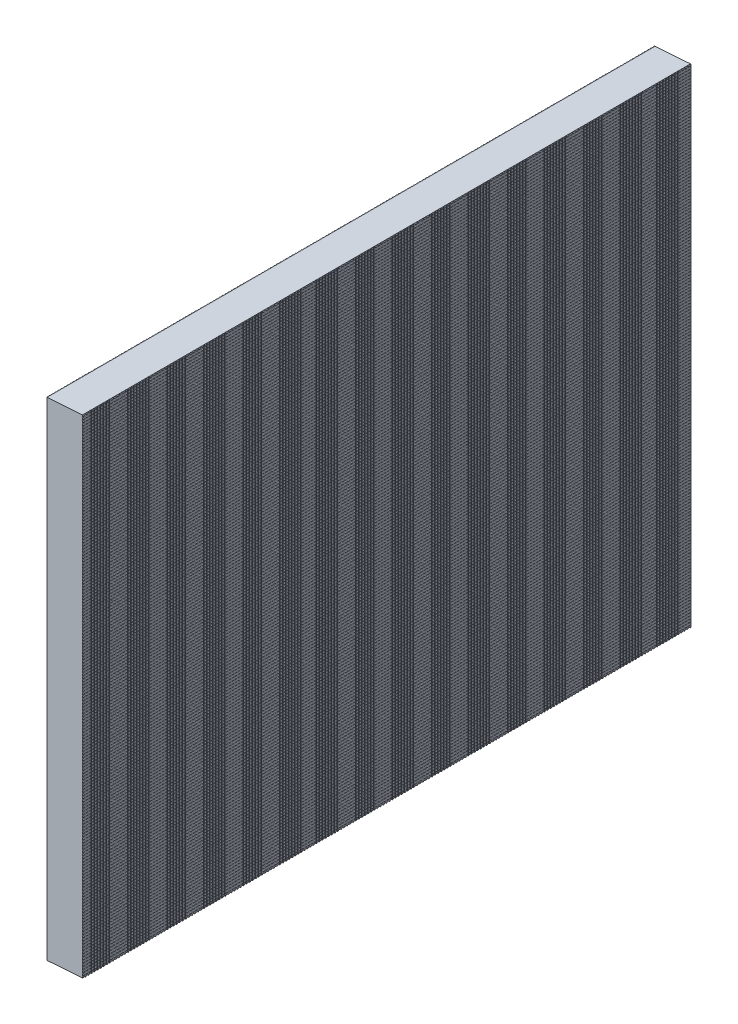
from build123d import *

# Parameters (mm, degrees)
BOSS_EXTRUDE1_DEPTH   = 400
SHELL1_T              = -1
SKETCH2_W             = 400
SKETCH2_H             = 320.8
BOSS_EXTRUDE2_DEPTH   = 0.6
CUT_EXTRUDE1_DEPTH    = 514.274663314
SKETCH4_W             = 0.4
SKETCH4_H             = 0.6
EXTRUDE_THIN1_DEPTH   = 400
EXTRUDE_THIN1_2_DEPTH = 400
LPATTERN1_COUNT       = 178
LPATTERN1_PITCH       = 1.8
SKETCH5_W             = 0.2
SKETCH5_H             = 0.6
BOSS_EXTRUDE3_DEPTH   = 320.8
BOSS_EXTRUDE4_START   = -319.777698
SKETCH6_W             = 0.2
SKETCH6_H             = 0.6
BOSS_EXTRUDE4_DEPTH   = 320.8
LPATTERN2_COUNT       = 200
LPATTERN2_PITCH       = 2
SKETCH7_R             = 7.795
SKETCH7_R_2           = 3.15
BOSS_EXTRUDE5_DEPTH   = 23.2
BOSS_EXTRUDE5_2_DEPTH = 23.2
BOSS_EXTRUDE5_3_DEPTH = 23.2
BOSS_EXTRUDE5_4_DEPTH = 23.2


with BuildPart() as part:
    # Sketch1 → Boss-Extrude1 (new body)
    with BuildSketch(Plane.XY):
        Polygon((0, 0), (0, 320.8), (-23.2, 319.177697963), (-23.2, -1.622302037), align=None)
    extrude(amount=BOSS_EXTRUDE1_DEPTH)

    # Shell1
    shell1_openings = [part.faces().sort_by_distance(p)[0] for p in [
        (0, 160.4, 200),
    ]]
    offset(amount=SHELL1_T, openings=shell1_openings, kind=Kind.INTERSECTION)

    # Sketch2 → Boss-Extrude2 (add)
    with BuildSketch(Plane(origin=(0, 0, 0), x_dir=(0, 0, -1), z_dir=(1, 0, 0))):
        with Locations((-200, 160.4)):
            Rectangle(SKETCH2_W, SKETCH2_H)
    extrude(amount=-BOSS_EXTRUDE2_DEPTH)

    # Sketch3 → Cut-Extrude1 (cut, through all)
    with BuildSketch(Plane(origin=(0, 0, 0), x_dir=(-1, 0, 0), z_dir=(0, 0, -1))):
        Polygon((0.6, 320.758043913), (0, 320.8), (0.6, 320.8), align=None)
    extrude(amount=-CUT_EXTRUDE1_DEPTH, mode=Mode.SUBTRACT)


with BuildPart() as body_2:
    # Sketch4 → Extrude-Thin1 (new body)
    with BuildSketch(Plane(origin=(0, 0, 0), x_dir=(-1, 0, 0), z_dir=(0, 0, -1))):
        with Locations((23.2, 318.877697963)):
            Rectangle(SKETCH4_W, SKETCH4_H)
    extrude_thin1 = extrude(amount=-EXTRUDE_THIN1_DEPTH)


with BuildPart() as body_3:
    # Sketch4 → Extrude-Thin1 2 (new body)
    with BuildSketch(Plane(origin=(0, 0, 0), x_dir=(-1, 0, 0), z_dir=(0, 0, -1))):
        with Locations((0, 319.477697963)):
            Rectangle(SKETCH4_W, SKETCH4_H)
    extrude_thin1_2 = extrude(amount=-EXTRUDE_THIN1_2_DEPTH)


with BuildPart() as lpattern1_1:
    # LPattern1: Extrude-Thin1, Extrude-Thin1 2 ×178
    with Locations(*[(0, -i * LPATTERN1_PITCH, 0) for i in range(1, LPATTERN1_COUNT)]):
        add(extrude_thin1)
        add(extrude_thin1_2)


with BuildPart() as body_358:
    # Sketch5 → Boss-Extrude3 (new body)
    with BuildSketch(Plane(origin=(0, 319.177697963, 0), x_dir=(1, 0, 0), z_dir=(0, 1, 0))):
        with Locations((-23.5, -0.3)):
            Rectangle(SKETCH5_W, SKETCH5_H)
    boss_extrude3 = extrude(amount=-BOSS_EXTRUDE3_DEPTH)


with BuildPart() as body_359:
    # Sketch6 → Boss-Extrude4 (new body)
    with BuildSketch(Plane(origin=(0, 319.777697963, 0), x_dir=(1, 0, 0), z_dir=(0, 1, 0)).offset(BOSS_EXTRUDE4_START)):
        with Locations((0.3, -0.3)):
            Rectangle(SKETCH6_W, SKETCH6_H)
    boss_extrude4 = extrude(amount=BOSS_EXTRUDE4_DEPTH)


with BuildPart() as lpattern2_1:
    # LPattern2: Boss-Extrude3, Boss-Extrude4 ×200
    with Locations(*[(0, 0, i * LPATTERN2_PITCH) for i in range(1, LPATTERN2_COUNT)]):
        add(boss_extrude3)
        add(boss_extrude4)


with BuildPart() as body_758:
    # Sketch7 → Boss-Extrude5 (new body)
    with BuildSketch(Plane.ZY.offset(23.2)):
        with Locations(Location((61.4, 298.396290577, 0), (0, 0, 270))):
            Circle(SKETCH7_R)
        with Locations(Location((61.4, 298.396290577, 0), (0, 0, 270))):
            Circle(SKETCH7_R_2, mode=Mode.SUBTRACT)
    extrude(amount=-BOSS_EXTRUDE5_DEPTH)


with BuildPart() as body_759:
    # Sketch7 → Boss-Extrude5 2 (new body)
    with BuildSketch(Plane.ZY.offset(23.2)):
        with Locations(Location((341.4, 298.396290577, 0), (0, 0, 270))):
            Circle(SKETCH7_R)
        with Locations(Location((341.4, 298.396290577, 0), (0, 0, 270))):
            Circle(SKETCH7_R_2, mode=Mode.SUBTRACT)
    extrude(amount=-BOSS_EXTRUDE5_2_DEPTH)


with BuildPart() as body_760:
    # Sketch7 → Boss-Extrude5 3 (new body)
    with BuildSketch(Plane.ZY.offset(23.2)):
        with Locations(Location((341.4, 18.396290577, 0), (0, 0, 270))):
            Circle(SKETCH7_R)
        with Locations(Location((341.4, 18.396290577, 0), (0, 0, 270))):
            Circle(SKETCH7_R_2, mode=Mode.SUBTRACT)
    extrude(amount=-BOSS_EXTRUDE5_3_DEPTH)


with BuildPart() as body_761:
    # Sketch7 → Boss-Extrude5 4 (new body)
    with BuildSketch(Plane.ZY.offset(23.2)):
        with Locations(Location((61.4, 18.396290577, 0), (0, 0, 270))):
            Circle(SKETCH7_R)
        with Locations(Location((61.4, 18.396290577, 0), (0, 0, 270))):
            Circle(SKETCH7_R_2, mode=Mode.SUBTRACT)
    extrude(amount=-BOSS_EXTRUDE5_4_DEPTH)


solid = Compound([part.part, body_2.part, body_3.part, lpattern1_1.part, body_358.part, body_359.part, lpattern2_1.part, body_758.part, body_759.part, body_760.part, body_761.part])
